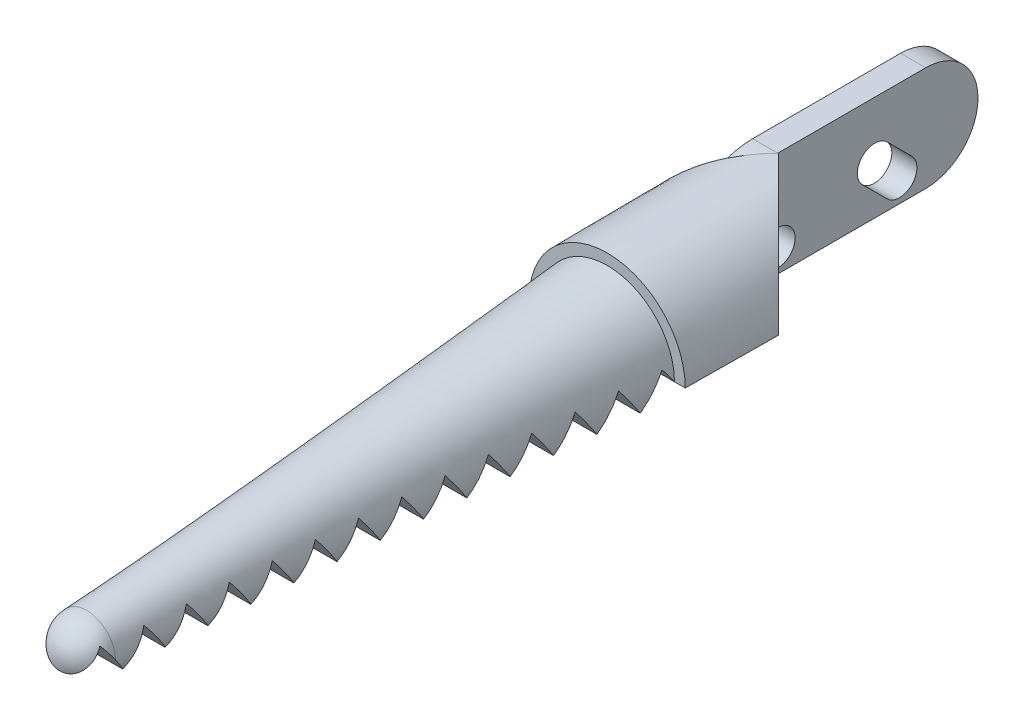
from build123d import *
from OCP.BRepAlgoAPI import BRepAlgoAPI_Cut
from OCP.TopTools import TopTools_ListOfShape

# Parameters (mm, degrees)
SKETCH4_R               = 2.235
SKETCH3_R               = 2.31
CUT_EXTRUDE1_DEPTH      = 27.58647073088115
CUT_EXTRUDE1_DEPTH_BACK = 27.58647073088115
BOSS_EXTRUDE1_DEPTH     = 0.72
CUT_EXTRUDE2_DEPTH      = 27.578153590375337
CUT_EXTRUDE2_DEPTH_BACK = 27.578153590375337
SKETCH11_R              = 0.5000000000000008
CUT_EXTRUDE3_DEPTH      = 27.578153590375337
CUT_EXTRUDE3_DEPTH_BACK = 27.578153590375337
CUT_EXTRUDE4_DEPTH      = 27.578153590375337
CUT_EXTRUDE4_DEPTH_BACK = 27.578153590375337


with BuildPart() as part:
    # Sketch4 → Loft1 section 0
    with BuildSketch(Plane.XY.offset(10.64)):
        Circle(SKETCH4_R)
    # Sketch3 → Loft1 section 1
    with BuildSketch(Plane.XY):
        Circle(SKETCH3_R)
    loft()

    # Loft2: read off the stored shape, not the designer's step
    # Loft2: loft between two sections, ruled curve by curve
    loft2_from = [
        Edge.make_bspline([(-1.907298859, 0.260453572, 10.64), (-2.428206003, -3.554144145, 10.64), (1.386391714, -4.07505129, 10.64), (1.907298859, -0.260453572, 10.64), (2.428206003, 3.554144145, 10.64), (-1.386391714, 4.07505129, 10.64), (-1.907298859, 0.260453572, 10.64)], [0, 0, 0, 0, 0.5, 0.5, 0.5, 1, 1, 1, 1], 3, [1, 0.333333333333333, 0.333333333333333, 1, 0.333333333333333, 0.333333333333333, 1]),
    ]
    loft2_to = [
        Edge.make_bspline([(-0.608448322, 0.557149567, 25.56), (-1.722747455, -0.659747077, 25.56), (-0.505850812, -1.77404621, 25.56), (0.608448322, -0.557149567, 25.56), (1.722747455, 0.659747077, 25.56), (0.505850812, 1.77404621, 25.56), (-0.608448322, 0.557149567, 25.56)], [0, 0, 0, 0, 0.5, 0.5, 0.5, 1, 1, 1, 1], 3, [1, 0.333333333333333, 0.333333333333333, 1, 0.333333333333333, 0.333333333333333, 1]),
    ]
    loft2 = Solid(Shell([*[Face.make_surface_from_curves(loft2_from[k], loft2_to[k]) for k in range(1)], Face(Wire(loft2_from)), Face(Wire(loft2_to))]))
    add(loft2)

    # Revolve3: read off the stored shape, not the designer's step
    # Revolve3 outline → Revolve3 (revolve)
    with BuildSketch(Plane.XZ):
        with BuildLine():
            Line((0, 25.56), (0.825, 25.56))
            ThreePointArc((0.825, 25.56), (0.583363094, 26.143363094), (0, 26.385))
            Line((0, 26.385), (0, 25.56))
        make_face()
    revolve(axis=Axis((0, 0, 0), (0, 0, 1)))


with BuildPart() as cut_extrude1_tool:
    # Sketch9 → Cut-Extrude1 (new, two sides: drawn at the far end of the back side and taken through both)
    with BuildSketch(Plane(origin=(0, 0, 0), x_dir=(0, 0, -1), z_dir=(1, 0, 0)).offset(-CUT_EXTRUDE1_DEPTH_BACK)):
        with BuildLine():
            Line((0, 2.31), (-5.74, 2.269539473684211))
            ThreePointArc((-5.74, 2.269539473684211), (-7.993598162174239, -2.37e-14), (-5.74, -2.2695394736842105))
            Line((-5.74, -2.2695394736842105), (0, -2.31))
            Line((0, -2.31), (0, 2.31))
        make_face()
    extrude(amount=CUT_EXTRUDE1_DEPTH + CUT_EXTRUDE1_DEPTH_BACK)


with BuildPart() as part_1:
    add(part.part)

    # Cut-Extrude1: cut by cut_extrude1_tool, with a tolerance
    cut_extrude1_stock = TopTools_ListOfShape()
    cut_extrude1_stock.Append(part_1.part.wrapped)
    cut_extrude1_tools = TopTools_ListOfShape()
    cut_extrude1_tools.Append(cut_extrude1_tool.part.wrapped)
    cut_extrude1_cut = BRepAlgoAPI_Cut()
    cut_extrude1_cut.SetArguments(cut_extrude1_stock)
    cut_extrude1_cut.SetTools(cut_extrude1_tools)
    cut_extrude1_cut.SetFuzzyValue(0.00001)
    cut_extrude1_cut.Build()
    add(Compound.cast(cut_extrude1_cut.Shape()).solids(), mode=Mode.REPLACE)

    # Sketch10 → Boss-Extrude1 (add)
    with BuildSketch(Plane(origin=(0, 0, 0), x_dir=(0, 0, -1), z_dir=(1, 0, 0))):
        with BuildLine():
            Line((-5.755997693658497, 2.2695958558327507), (-1.515997693658497, 2.2695958558327507))
            ThreePointArc((-1.515997693658497, 2.2695958558327507), (-0.01599769365849646, 0.769595855832751), (-1.5159976936584965, -0.7304041441672493))
            Line((-1.5159976936584965, -0.7304041441672493), (-5.755997693658497, -0.7304041441672493))
            ThreePointArc((-5.755997693658497, -0.7304041441672493), (-6.300456135431979, -0.5691848113978423), (-6.754869150888661, -0.22869181666727964))
            ThreePointArc((-6.754869150888661, -0.22869181666727964), (-7.3637940337605725, -0.01339161533026489), (-8.009638140649475, -0.0079990952139372))
            ThreePointArc((-8.009638140649475, -0.0079990952139372), (-7.353348220945002, 1.5963799024633214), (-5.755997693658497, 2.2695958558327507))
        make_face()
    extrude(amount=-BOSS_EXTRUDE1_DEPTH)

    # Sketch11 → Cut-Extrude2 (cut, two sides: drawn at the far end of the back side and taken through both)
    with BuildSketch(Plane(origin=(0, 0, 0), x_dir=(0, 0, -1), z_dir=(1, 0, 0)).offset(-CUT_EXTRUDE2_DEPTH_BACK)):
        with Locations(Location((-5.755997693658496, -0.08040414416724939, 0), (0, 0, 179.999999999))):
            Circle(SKETCH11_R)
    extrude(amount=CUT_EXTRUDE2_DEPTH + CUT_EXTRUDE2_DEPTH_BACK, mode=Mode.SUBTRACT)

    # Sketch12 → Cut-Extrude3 (cut, two sides: drawn at the far end of the back side and taken through both)
    with BuildSketch(Plane(origin=(0, 0, 0), x_dir=(0, 0, -1), z_dir=(1, 0, 0)).offset(-CUT_EXTRUDE3_DEPTH_BACK)):
        with BuildLine():
            Line((-2.61955108425177, -0.4339575347605234), (-3.326657865438317, 0.2731492464260242))
            ThreePointArc((-3.326657865438317, 0.2731492464260242), (-3.3266578654383174, 0.980256027612572), (-2.6195510842517695, 0.9802560276125718))
            Line((-2.6195510842517695, 0.9802560276125718), (-1.9124443030652216, 0.27314924642602484))
            ThreePointArc((-1.9124443030652216, 0.27314924642602484), (-1.9124443030652214, -0.43395753476052357), (-2.61955108425177, -0.4339575347605234))
        make_face()
    extrude(amount=CUT_EXTRUDE3_DEPTH + CUT_EXTRUDE3_DEPTH_BACK, mode=Mode.SUBTRACT)

    # Sketch8 → Cut-Extrude4 (cut, two sides: drawn at the far end of the back side and taken through both)
    with BuildSketch(Plane(origin=(0, 0, 0), x_dir=(0, 0, -1), z_dir=(1, 0, 0)).offset(-CUT_EXTRUDE4_DEPTH_BACK)):
        Polygon((-10.64, 4.3e-16), (-10.92678821817553, 0.4095760221444918), (-11.500364653175215, -0.40957602021520884), (-12.073941088175136, 0.40957602214423094), (-12.647517523174814, -0.40957602021521683), (-13.221093958174729, 0.40957602214440114), (-13.794670393174655, -0.40957602021506484), (-14.368246828174327, 0.4095760221443932), (-14.941823263174012, -0.409576020215047), (-15.515399698173928, 0.40957602214438515), (-16.088976133173613, -0.409576020215055), (-16.662552568173783, 0.40957602214437716), (-17.236129003173215, -0.4095760202152489), (-17.809705438173125, 0.4095760221443691), (-18.38328187317281, -0.40957602021507106), (-18.956858308172723, 0.4095760221443611), (-19.53043474317241, -0.40957602021507905), (-20.10401117817232, 0.4095760221443531), (-20.67758761317201, -0.4095760202150871), (-21.25116404817192, 0.4095760221443451), (-21.82474048317161, -0.4095760202150951), (-22.398316918171524, 0.4095760221443371), (-22.971893353171208, -0.40957602021510314), (-23.545469788171122, 0.4095760221443291), (-24.119046223170805, -0.4095760202151111), (-24.69262265817072, 0.4095760221443211), (-25.266199093170407, -0.40957602021511913), (-25.839775528170343, 0.4095760221440387), (-26.413351963170005, -0.4095760202151271), (-26.986928398169923, 0.40957602214430294), (-26.986928398169923, -4.419260588317123), (-4.451704701186554, -4.419260588317123), (-4.451704701186554, -2.80017242629016), (-7.993591564895423, -0.00547231851227717), align=None)
    extrude(amount=CUT_EXTRUDE4_DEPTH + CUT_EXTRUDE4_DEPTH_BACK, mode=Mode.SUBTRACT)


solid = part_1.part
